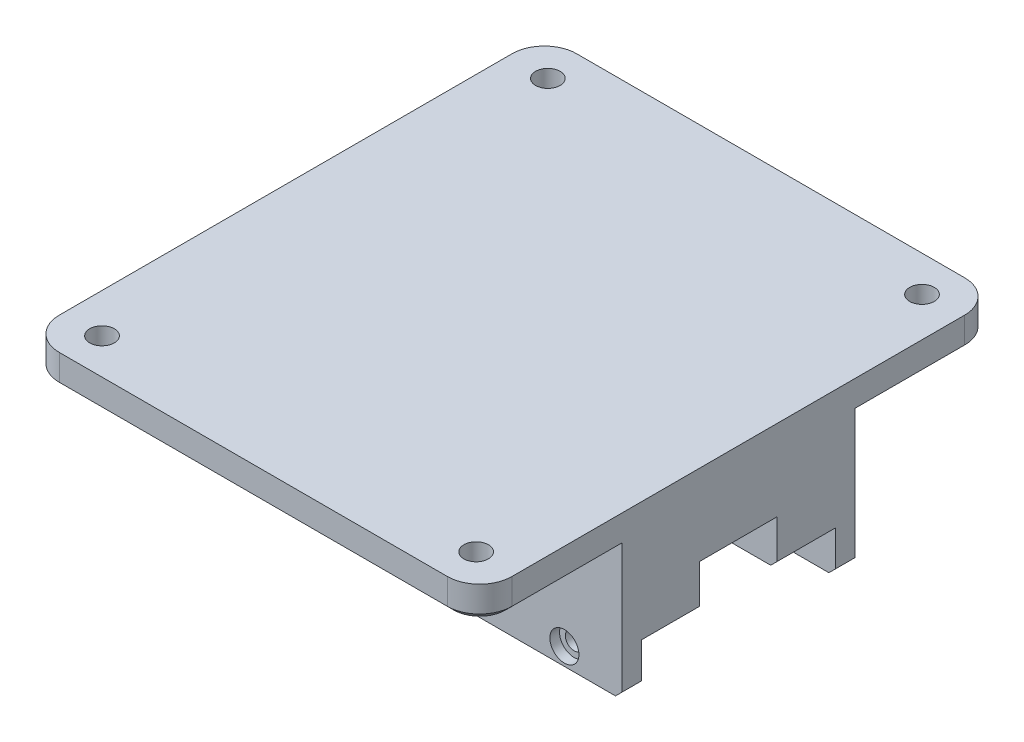
from build123d import *

# Parameters (mm, degrees)
BOSS_EXTRUDE1_DEPTH        = 18
CROQUIS2_R                 = 1.35
CORTAR_EXTRUIR2_DEPTH      = 5
SKETCH3_R                  = 2.25
CUT_EXTRUDE1_DEPTH         = 1.5
CORTAR_EXTRUIR3_START      = 3
CORTAR_EXTRUIR3_DEPTH      = 17
CORTAR_EXTRUIR4_DEPTH      = 50.79015967
CORTAR_EXTRUIR4_DEPTH_BACK = 6
CROQUIS4_W                 = 70
CROQUIS4_H                 = 12
CORTAR_EXTRUIR11_DEPTH     = 60.498739482
CROQUIS6_W                 = 70
CROQUIS6_H                 = 80
CROQUIS6_R                 = 1.9
SALIENTE_EXTRUIR1_DEPTH    = 5
REDONDEO1_R                = 5
CHAFL_N1_SIZE              = 1
CHAFL_N2_SIZE              = 1
CHAFL_N3_SIZE              = 1
CHAFL_N5_SIZE              = 1
CHAFL_N6_SIZE              = 2


# Some blends are built 0.0001 mm under size
with BuildPart() as part:
    # Sketch1 → Boss-Extrude1 (new body)
    with BuildSketch(Plane.XY):
        Polygon((25.9, 17.3), (-9.1, 17.3), (-44.1, 17.3), (-44.1, -2.7), (-9.1, -2.7), (25.9, -2.7), (25.9, 2.5), align=None)
    boss_extrude1 = extrude(amount=BOSS_EXTRUDE1_DEPTH)

    # Croquis2 → Cortar-Extruir2 (cut)
    with BuildSketch(Plane.XY.offset(18)):
        Circle(CROQUIS2_R)
        with Locations((17, 0)):
            Circle(CROQUIS2_R)
        with Locations((-18.2, 0)):
            Circle(CROQUIS2_R)
        with Locations((-35.2, 0)):
            Circle(CROQUIS2_R)
    cortar_extruir2 = extrude(amount=-CORTAR_EXTRUIR2_DEPTH, mode=Mode.SUBTRACT)

    # Sketch3 → Cut-Extrude1 (cut)
    with BuildSketch(Plane.XY.offset(18)):
        Circle(SKETCH3_R)
        with Locations((17, 0)):
            Circle(SKETCH3_R)
        with Locations((-18.2, 0)):
            Circle(SKETCH3_R)
        with Locations((-35.2, 0)):
            Circle(SKETCH3_R)
    cut_extrude1 = extrude(amount=-CUT_EXTRUDE1_DEPTH, mode=Mode.SUBTRACT)

    # Croquis3 → Cortar-Extruir3 (cut)
    with BuildSketch(Plane(origin=(0, 0, 18), x_dir=(-1, 0, 0), z_dir=(0, 0, -1)).offset(CORTAR_EXTRUIR3_START)):
        Polygon((-25.9, -2.7), (-25.9, 2.8), (4.1, 2.8), (9.1, -2.2), (14.1, 2.8), (44.1, 2.8), (44.1, -2.7), align=None)
    cortar_extruir3 = extrude(amount=CORTAR_EXTRUIR3_DEPTH, mode=Mode.SUBTRACT)

    # Mirror1: Boss-Extrude1, Cortar-Extruir2, Cut-Extrude1, Cortar-Extruir3 across plane
    add(boss_extrude1.mirror(Plane(origin=(0, 0, 0), x_dir=(1, 0, 0), z_dir=(0, 0, -1))))
    add(cortar_extruir2.mirror(Plane(origin=(0, 0, 0), x_dir=(1, 0, 0), z_dir=(0, 0, -1))), mode=Mode.SUBTRACT)
    add(cut_extrude1.mirror(Plane(origin=(0, 0, 0), x_dir=(1, 0, 0), z_dir=(0, 0, -1))), mode=Mode.SUBTRACT)
    add(cortar_extruir3.mirror(Plane(origin=(0, 0, 0), x_dir=(1, 0, 0), z_dir=(0, 0, -1))), mode=Mode.SUBTRACT)

    # Croquis4 → Cortar-Extruir4 (cut, two sides: drawn at the far end of the back side and taken through both)
    with BuildSketch(Plane.XZ.offset(-2.8).offset(-CORTAR_EXTRUIR4_DEPTH_BACK)):
        with Locations((-9.1, 0)):
            Rectangle(CROQUIS4_W, CROQUIS4_H)
    extrude(amount=CORTAR_EXTRUIR4_DEPTH + CORTAR_EXTRUIR4_DEPTH_BACK, mode=Mode.SUBTRACT)

    # Croquis5 → Cortar-Extruir11 (cut, through all)
    with BuildSketch(Plane.XY.offset(18)):
        Polygon((-13.1, 10.671649133), (-13.1, 16.3), (-5.1, 16.3), (-5.1, 11.3), (-5.1, 6.3), (-13.1, 6.3), align=None)
    extrude(amount=-CORTAR_EXTRUIR11_DEPTH, mode=Mode.SUBTRACT)

    # Croquis6 → Saliente-Extruir1 (add)
    with BuildSketch(Plane(origin=(0, 17.3, 0), x_dir=(1, 0, 0), z_dir=(0, 1, 0))):
        with Locations((-9.1, 0)):
            Rectangle(CROQUIS6_W, CROQUIS6_H)
        with Locations(Location((-38.025442436, -34.47199994, 0), (0, 0, 180))):
            Circle(CROQUIS6_R, mode=Mode.SUBTRACT)
        with Locations((19.825442436, -34.47199994)):
            Circle(CROQUIS6_R, mode=Mode.SUBTRACT)
        with Locations(Location((19.825442436, 34.47199994, 0), (0, 0, 180))):
            Circle(CROQUIS6_R, mode=Mode.SUBTRACT)
        with Locations((-38.025442436, 34.47199994)):
            Circle(CROQUIS6_R, mode=Mode.SUBTRACT)
    extrude(amount=SALIENTE_EXTRUIR1_DEPTH)

    # Redondeo1
    redondeo1_edges = [part.edges().sort_by_distance(p)[0] for p in [
        (25.9, 19.8, 40),
        (25.9, 19.8, -40),
        (-44.1, 19.8, -40),
        (-44.1, 19.8, 40),
    ]]
    fillet(redondeo1_edges, radius=REDONDEO1_R)

    # Chaflán1
    chafl_n1_edges = [part.edges().sort_by_distance(p)[0] for p in [
        (-13.1, 11.3, 18),
        (-9.1, 6.3, 18),
        (-5.1, 11.3, 18),
        (-9.1, 16.3, 18),
    ]]
    chamfer(chafl_n1_edges, length=CHAFL_N1_SIZE - 0.0001)  # a hair under: the kernel refuses the full size

    # Chaflán2
    chafl_n2_edges = [part.edges().sort_by_distance(p)[0] for p in [
        (-9.1, 6.3, -18),
        (-13.1, 11.3, -18),
        (-5.1, 11.3, -18),
        (-9.1, 16.3, -18),
    ]]
    chamfer(chafl_n2_edges, length=CHAFL_N2_SIZE - 0.0001)  # a hair under: the kernel refuses the full size

    # Chaflán3
    chafl_n3_edges = [part.edges().sort_by_distance(p)[0] for p in [
        (25.9, 17.3, -26.5),
        (-44.1, 17.3, 26.5),
        (25.9, 17.3, 26.5),
        (-9.1, 17.3, 40),
        (-42.635533906, 17.3, 38.535533906),
        (24.435533906, 17.3, 38.535533906),
        (-44.1, 17.3, -26.5),
        (-9.1, 17.3, -40),
        (-42.635533906, 17.3, -38.535533906),
        (24.435533906, 17.3, -38.535533906),
    ]]
    chamfer(chafl_n3_edges, length=CHAFL_N3_SIZE)

    # Chaflán5
    chafl_n5_edges = [part.edges().sort_by_distance(p)[0] for p in [
        (25.9, -2.7, -16.5),
        (-44.1, -2.7, 16.5),
        (25.9, -2.7, 16.5),
        (25.9, 2.8, 10.5),
        (-44.1, 2.8, 10.5),
        (-44.1, 8.8, 0),
        (25.9, 8.8, 0),
        (-44.1, 2.8, -10.5),
        (25.9, 2.8, -10.5),
        (-44.1, -2.7, -16.5),
    ]]
    chamfer(chafl_n5_edges, length=CHAFL_N5_SIZE)

    # Chaflán6
    # the kernel refuses this chamfer: 2 mm, written as the material it adds along each edge
    with BuildSketch(Plane(origin=(-48.243365976, 17.3, 18), x_dir=(0, -0.9996219169112968, -0.027495876610585623), z_dir=(1, 0, 0))) as chafl_n6_piece_1_section:
        Polygon((CHAFL_N6_SIZE * 0.999621916911, -CHAFL_N6_SIZE * 0.0274958766106), (-CHAFL_N6_SIZE * 0.0274958766106, -CHAFL_N6_SIZE * 0.999621916911), (0, 0), align=None)
    chafl_n6_piece_1 = extrude(amount=78.286731952, mode=Mode.PRIVATE)
    chafl_n6_piece_1 = split(chafl_n6_piece_1, bisect_by=Plane(origin=(-21.681250309, 16.637349381, 25.581350309), z_dir=(-0.7071067811865476, 0, -0.7071067811865476)), keep=Keep.TOP, mode=Mode.PRIVATE)
    chafl_n6_piece_1 = split(chafl_n6_piece_1, bisect_by=Plane(origin=(-35.518649691, 9.718649691, 18.662650619), z_dir=(0.7071067811865476, 0.7071067811865476, 0)), keep=Keep.TOP, mode=Mode.PRIVATE)
    add(chafl_n6_piece_1)
    with BuildSketch(Plane(origin=(-48.243365976, 17.3, 18), x_dir=(0, -0.9996219169112968, -0.027495876610585623), z_dir=(1, 0, 0))) as chafl_n6_piece_2_section:
        Polygon((CHAFL_N6_SIZE * 0.999621916911, -CHAFL_N6_SIZE * 0.0274958766106), (-CHAFL_N6_SIZE * 0.0274958766106, -CHAFL_N6_SIZE * 0.999621916911), (0, 0), align=None)
    chafl_n6_piece_2 = extrude(amount=78.286731952, mode=Mode.PRIVATE)
    chafl_n6_piece_2 = split(chafl_n6_piece_2, bisect_by=Plane(origin=(17.318649691, 9.718649691, 18.662650619), z_dir=(-0.7071067811865476, 0.7071067811865476, 0)), keep=Keep.TOP, mode=Mode.PRIVATE)
    chafl_n6_piece_2 = split(chafl_n6_piece_2, bisect_by=Plane(origin=(3.481250309, 16.637349381, 25.581350309), z_dir=(0.7071067811865476, 0, -0.7071067811865476)), keep=Keep.TOP, mode=Mode.PRIVATE)
    add(chafl_n6_piece_2)
    with BuildSketch(Plane(origin=(-48.243365976, 17.3, -18), x_dir=(0, -0.9996219169112968, 0.027495876610585623), z_dir=(1, 0, 0))) as chafl_n6_piece_3_section:
        Polygon((CHAFL_N6_SIZE * 0.999621916911, CHAFL_N6_SIZE * 0.0274958766106), (-CHAFL_N6_SIZE * 0.0274958766106, CHAFL_N6_SIZE * 0.999621916911), (0, 0), align=None)
    chafl_n6_piece_3 = extrude(amount=78.286731952, mode=Mode.PRIVATE)
    chafl_n6_piece_3 = split(chafl_n6_piece_3, bisect_by=Plane(origin=(-21.681250309, 16.637349381, -25.581350309), z_dir=(-0.7071067811865476, 0, 0.7071067811865476)), keep=Keep.TOP, mode=Mode.PRIVATE)
    chafl_n6_piece_3 = split(chafl_n6_piece_3, bisect_by=Plane(origin=(-35.518649691, 9.718649691, -18.662650619), z_dir=(0.7071067811865476, 0.7071067811865476, 0)), keep=Keep.TOP, mode=Mode.PRIVATE)
    add(chafl_n6_piece_3)
    with BuildSketch(Plane(origin=(-48.243365976, 17.3, -18), x_dir=(0, -0.9996219169112968, 0.027495876610585623), z_dir=(1, 0, 0))) as chafl_n6_piece_4_section:
        Polygon((CHAFL_N6_SIZE * 0.999621916911, CHAFL_N6_SIZE * 0.0274958766106), (-CHAFL_N6_SIZE * 0.0274958766106, CHAFL_N6_SIZE * 0.999621916911), (0, 0), align=None)
    chafl_n6_piece_4 = extrude(amount=78.286731952, mode=Mode.PRIVATE)
    chafl_n6_piece_4 = split(chafl_n6_piece_4, bisect_by=Plane(origin=(3.481250309, 16.637349381, -25.581350309), z_dir=(0.7071067811865476, 0, 0.7071067811865476)), keep=Keep.TOP, mode=Mode.PRIVATE)
    chafl_n6_piece_4 = split(chafl_n6_piece_4, bisect_by=Plane(origin=(17.318649691, 9.718649691, -18.662650619), z_dir=(-0.7071067811865476, 0.7071067811865476, 0)), keep=Keep.TOP, mode=Mode.PRIVATE)
    add(chafl_n6_piece_4)


solid = part.part
